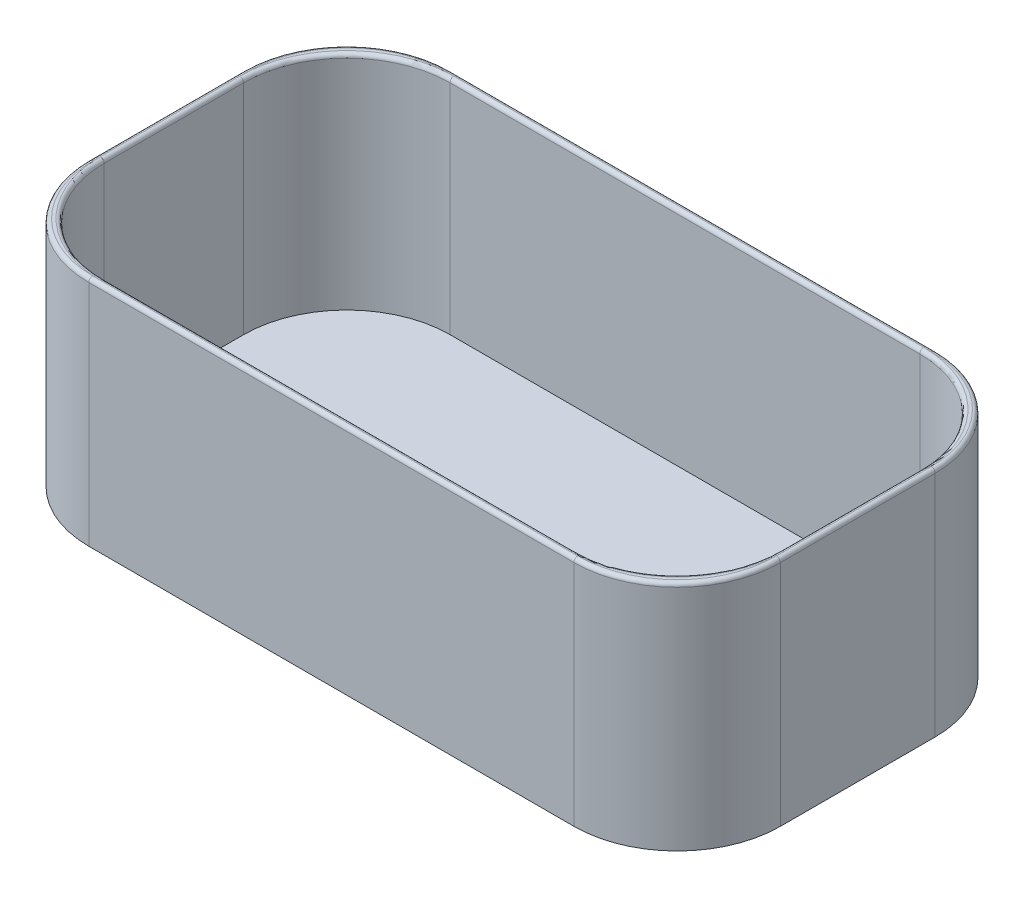
from build123d import *

# Parameters (mm, degrees)
SKETCH_1_W          = 134
SKETCH_1_H          = 70
EXTRUDE_1_DEPTH     = 45
SKETCH_2_W          = 131
SKETCH_2_H          = 67
CUT_EXTRUDE_1_DEPTH = 43
FILLET_1_R          = 20
FILLET_2_R          = 0.75


with BuildPart() as part:
    # 草图1 → 凸台-拉伸1 (new body)
    with BuildSketch(Plane(origin=(0, 0, 0), x_dir=(1, 0, 0), z_dir=(0, 1, 0))):
        Rectangle(SKETCH_1_W, SKETCH_1_H)
    extrude(amount=EXTRUDE_1_DEPTH)

    # 草图2 → 切除-拉伸1 (cut)
    with BuildSketch(Plane(origin=(0, 45, 0), x_dir=(1, 0, 0), z_dir=(0, 1, 0))):
        Rectangle(SKETCH_2_W, SKETCH_2_H)
    extrude(amount=-CUT_EXTRUDE_1_DEPTH, mode=Mode.SUBTRACT)

    # 圆角1
    fillet_1_edges = [part.edges().sort_by_distance(p)[0] for p in [
        (-65.5, 23.5, 33.5),
        (65.5, 23.5, 33.5),
        (65.5, 23.5, -33.5),
        (-65.5, 23.5, -33.5),
        (-67, 22.5, 35),
        (67, 22.5, 35),
        (67, 22.5, -35),
        (-67, 22.5, -35),
    ]]
    fillet(fillet_1_edges, radius=FILLET_1_R)

    # 圆角2
    fillet_2_edges = [part.edges().sort_by_distance(p)[0] for p in [
        (0, 45, 33.5),
        (-65.5, 45, 0),
        (0, 45, 35),
        (-67, 45, 0),
        (0, 45, -35),
        (0, 45, -33.5),
        (65.5, 45, 0),
        (67, 45, 0),
        (-59.642135624, 45, 27.642135624),
        (-59.642135624, 45, -27.642135624),
        (59.642135624, 45, -27.642135624),
        (59.642135624, 45, 27.642135624),
        (61.142135624, 45, -29.142135624),
        (61.142135624, 45, 29.142135624),
        (-61.142135624, 45, -29.142135624),
        (-61.142135624, 45, 29.142135624),
    ]]
    fillet(fillet_2_edges, radius=FILLET_2_R - 0.0001)  # a hair under: the kernel refuses the full size


solid = part.part
